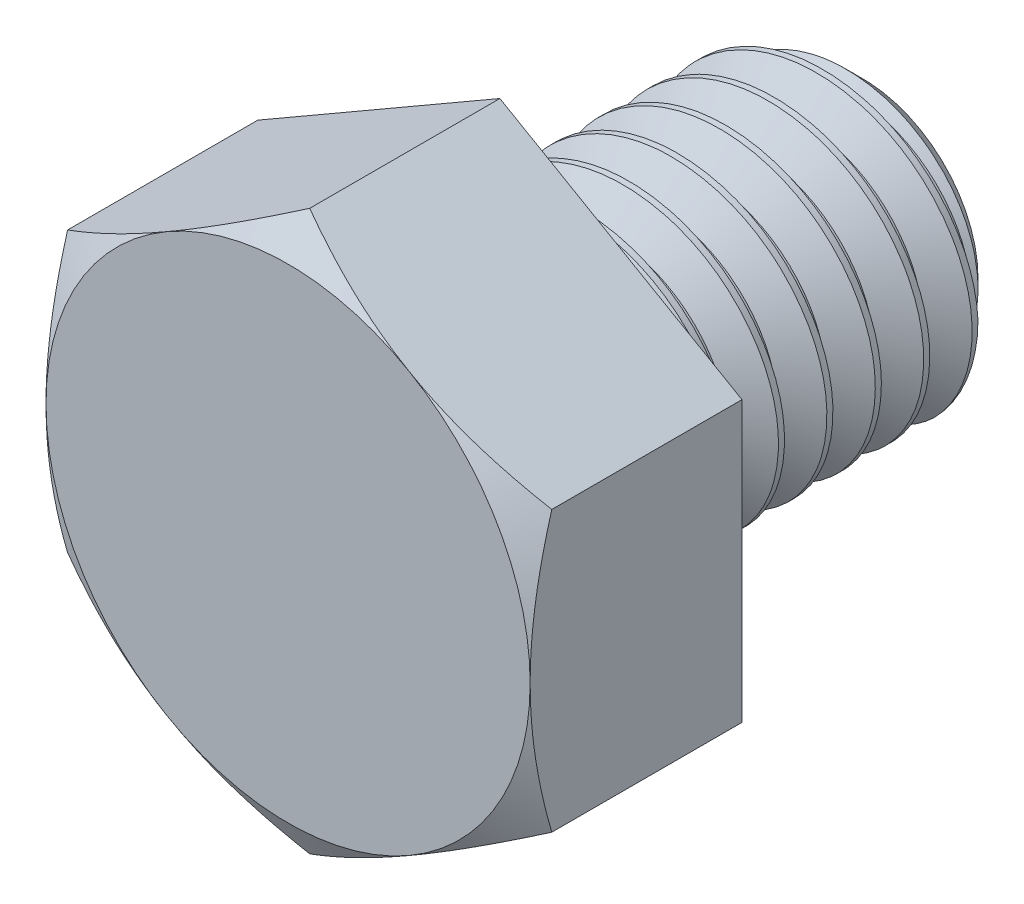
from build123d import *

# Parameters (mm, degrees)
BOSS_EXTRUDE1_DEPTH = 3.5
SKETCH4_OUTSIDE_W   = 55.688
SKETCH4_OUTSIDE_H   = 56.926
SKETCH4_OUTSIDE_R   = 4
CUT_EXTRUDE1_DEPTH  = 12.29527925
CUT_EXTRUDE1_DRAFT  = -60
CUT_SWEEP1_PITCH    = 0.8
CUT_SWEEP1_TO       = 6
SKETCH8_R           = 2.5
BOSS_EXTRUDE2_DEPTH = 6
BOSS_EXTRUDE2_TAPER = 20


with BuildPart() as part:
    # Sketch2 → Revolve1 (revolve)
    with BuildSketch(Plane(origin=(0, 0, 0), x_dir=(0, 0, -1), z_dir=(1, 0, 0)), mode=Mode.PRIVATE) as revolve1_sk:
        Polygon((-4.75, 4), (-4.75, 0), (4.75, 0), (4.75, 1.9), (4.15, 2.5), (-1.25, 2.5), (-1.25, 4), align=None)
    revolve(revolve1_sk.sketch.rotate(Axis((0, 0, 4.75), (0, 0, -1)), 90), axis=Axis((0, 0, 4.75), (0, 0, -1)))

    # Sketch3 → Boss-Extrude1 (add)
    with BuildSketch(Plane.XY.offset(4.75)):
        Polygon((0, 4.618802154), (-4, 2.309401077), (-4, -2.309401077), (0, -4.618802154), (4, -2.309401077), (4, 2.309401077), align=None)
    extrude(amount=-BOSS_EXTRUDE1_DEPTH)


with BuildPart() as cut_extrude1_tool:
    # Sketch4 outside → Cut-Extrude1 (with draft: the straight prism first)
    with BuildSketch(Plane.XY.offset(4.75)):
        Rectangle(SKETCH4_OUTSIDE_W, SKETCH4_OUTSIDE_H)
        Circle(SKETCH4_OUTSIDE_R, mode=Mode.SUBTRACT)
    extrude(amount=-CUT_EXTRUDE1_DEPTH)
    # Cut-Extrude1: the draft: its side faces are tilted about the plane it starts from
    cut_extrude1_sides = [cut_extrude1_tool.faces().sort_by_distance(p)[0] for p in [
        (0, -28.463, -1.397639625),
        (27.844, 0, -1.397639625),
        (0, 28.463, -1.397639625),
        (-27.844, 0, -1.397639625),
        (-4, 0, -1.397639625),
    ]]
    draft(cut_extrude1_sides, Plane.XY.offset(4.75), CUT_EXTRUDE1_DRAFT)


with BuildPart() as part_1:
    add(part.part)

    # Cut-Extrude1: cut by cut_extrude1_tool
    add(cut_extrude1_tool.part, mode=Mode.SUBTRACT)


with BuildPart() as body_2:
    # Split1: read off the stored shape, not the designer's step
    # Split1: the piece on the far side of the plane
    add(part_1.part)
    split(bisect_by=Plane.XY.offset(1.25), keep=Keep.BOTTOM)

    # Cut-Sweep1: arcs per turn and ends read off the stored shape
    # Cut-Sweep1: the profile of Sketch7 screwed along a right-hand helix through 8.5 turns, 8 arcs to a turn; built about Z, then put on its axis
    cut_sweep1_z = Axis((0, 0, 0), (0, 0, 1))
    cut_sweep1_corners = [(2.54330127, 0, 0.025), (1.980384758, 0, -0.3), (1.980384758, 0, -0.4), (2.54330127, 0, -0.725)]
    with BuildLine(mode=Mode.PRIVATE) as cut_sweep1_profile:
        Line(cut_sweep1_corners[0], cut_sweep1_corners[1])
        Line(cut_sweep1_corners[1], cut_sweep1_corners[2])
        Line(cut_sweep1_corners[2], cut_sweep1_corners[3])
        Line(cut_sweep1_corners[3], cut_sweep1_corners[0])
    cut_sweep1_cap = Face(cut_sweep1_profile.wire())
    cut_sweep1_turn_angles = [0, 22.5, 45, 67.5, 90, 112.5, 135, 157.5, 180, 202.5, 225, 247.5, 270, 292.5, 315, 337.5, 360]
    cut_sweep1_turn_weights = [1, 0.9238795325112867, 1, 0.9238795325112867, 1, 0.9238795325112867, 1, 0.9238795325112867, 1, 0.9238795325112867, 1, 0.9238795325112867, 1, 0.9238795325112867, 1, 0.9238795325112867, 1]
    cut_sweep1_turn_rails = [Edge.make_bspline([Vector(p[0], p[1], 0).rotate(cut_sweep1_z, cut_sweep1_turn_angles[k]) / cut_sweep1_turn_weights[k] + Vector(0, 0, p[2] + CUT_SWEEP1_PITCH * cut_sweep1_turn_angles[k] / 360) for k in range(17)], [0, 0, 0, 1, 1, 2, 2, 3, 3, 4, 4, 5, 5, 6, 6, 7, 7, 8, 8, 8], 2, cut_sweep1_turn_weights) for p in cut_sweep1_corners]
    cut_sweep1_turn_sides = [Face.make_surface_from_curves(cut_sweep1_turn_rails[p[0]], cut_sweep1_turn_rails[p[1]]) for p in [(0, 1), (1, 2), (2, 3), (3, 0)]]
    cut_sweep1_last_angles = [2880, 2902.5, 2925, 2947.5, 2970, 2992.5, 3015, 3037.5, 3060]
    cut_sweep1_last_weights = [1, 0.9238795325112867, 1, 0.9238795325112867, 1, 0.9238795325112867, 1, 0.9238795325112792, 1]
    cut_sweep1_last_rails = [Edge.make_bspline([Vector(p[0], p[1], 0).rotate(cut_sweep1_z, cut_sweep1_last_angles[k]) / cut_sweep1_last_weights[k] + Vector(0, 0, p[2] + CUT_SWEEP1_PITCH * cut_sweep1_last_angles[k] / 360) for k in range(9)], [0, 0, 0, 1, 1, 2, 2, 3, 3, 4, 4, 4], 2, cut_sweep1_last_weights) for p in cut_sweep1_corners]
    cut_sweep1_last_sides = [Face.make_surface_from_curves(cut_sweep1_last_rails[p[0]], cut_sweep1_last_rails[p[1]]) for p in [(0, 1), (1, 2), (2, 3), (3, 0)]]
    cut_sweep1 = Plane(origin=(0, 0, -4.75), x_dir=(0, 1, 0), z_dir=(0, 0, 1)) * split(Solid(Shell([*[p.moved(Location((0, 0, CUT_SWEEP1_PITCH * i))) for i in range(8) for p in cut_sweep1_turn_sides], *cut_sweep1_last_sides, cut_sweep1_cap, cut_sweep1_cap.rotate(cut_sweep1_z, 3060).moved(Location((0, 0, CUT_SWEEP1_PITCH * 3060 / 360)))])), bisect_by=Plane.XY.offset(CUT_SWEEP1_TO), keep=Keep.BOTTOM, mode=Mode.PRIVATE)
    add(cut_sweep1, mode=Mode.SUBTRACT)


with BuildPart() as part_2:
    add(part_1.part)

    # Split1
    split(bisect_by=Plane.XY.offset(1.25), keep=Keep.TOP)

    add(body_2.part)  # Boss-Extrude2 merges body 2
    # Sketch8 → Boss-Extrude2 (add)
    with BuildSketch(Plane(origin=(0, 0, 1.25), x_dir=(-1, 0, 0), z_dir=(0, 0, -1))):
        Circle(SKETCH8_R)
    extrude(amount=BOSS_EXTRUDE2_DEPTH, taper=BOSS_EXTRUDE2_TAPER)


solid = part_2.part
